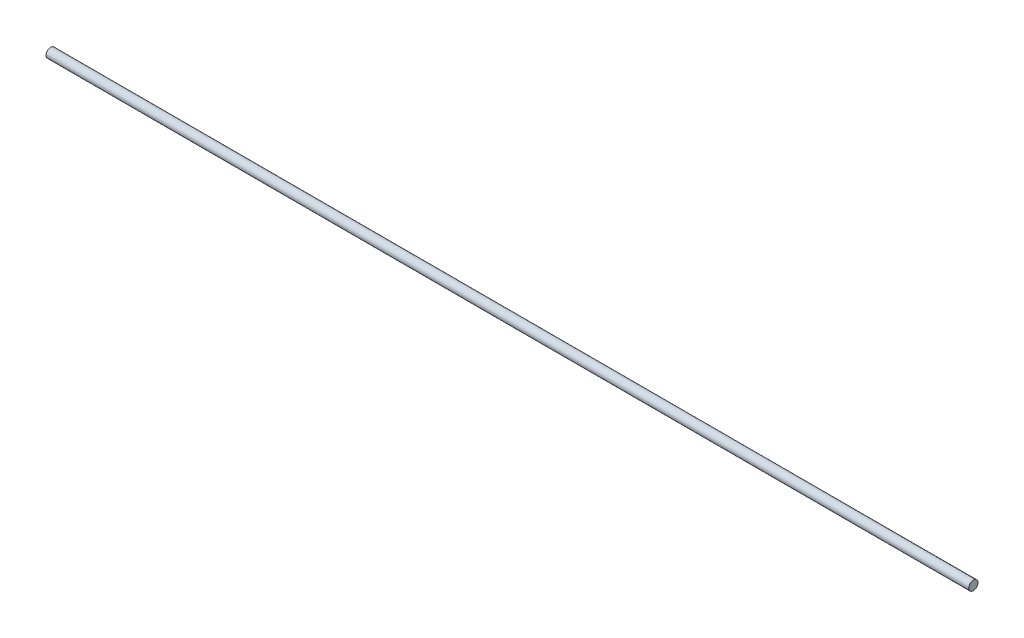
from build123d import *

# Parameters (mm, degrees)
CROQUIS1_R              = 4
SALIENTE_EXTRUIR1_DEPTH = 795.2


with BuildPart() as part:
    # Croquis1 → Saliente-Extruir1 (new body)
    with BuildSketch(Plane(origin=(0, 0, 0), x_dir=(0, 0, -1), z_dir=(1, 0, 0))):
        Circle(CROQUIS1_R)
    extrude(amount=SALIENTE_EXTRUIR1_DEPTH)


solid = part.part
